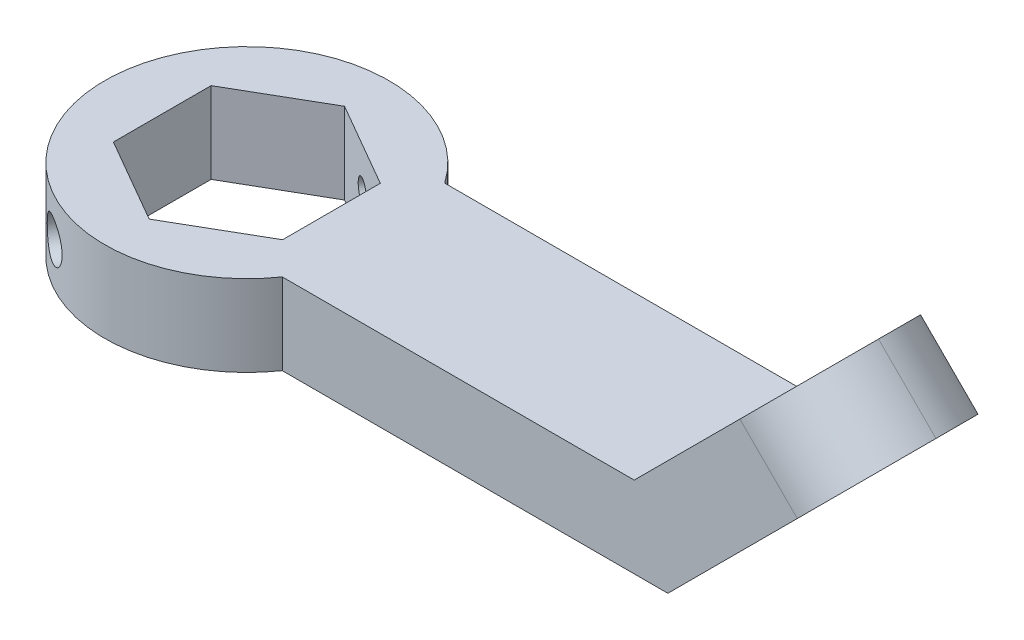
from build123d import *

# Parameters (mm, degrees)
BOSS_EXTRUDE1_DEPTH = 12
SKETCH4_W           = 39.051681067
SKETCH4_H           = 24
SKETCH4_R           = 4
BOSS_EXTRUDE2_DEPTH = 12
SKETCH4_3_R         = 8
SKETCH4_3_R_2       = 4
CUT_EXTRUDE1_DEPTH  = 5.15
FILLET1_R           = 12
SKETCH5_R           = 1.7
CUT_EXTRUDE2_DEPTH  = 107.997244305
CUT_EXTRUDE3_START  = -5
SKETCH5_3_R         = 3
CUT_EXTRUDE3_DEPTH  = 102.997244335


with BuildPart() as part:
    # Sketch3 → Boss-Extrude1 (new body)
    with BuildSketch(Plane(origin=(0, 0, 0), x_dir=(1, 0, 0), z_dir=(0, 1, 0))):
        with BuildLine():
            Line((-4.215390309, -12), (-17.23368794, -12))
            ThreePointArc((-17.23368794, -12), (0, -21), (17.23368794, -12))
            Line((17.23368794, -12), (4.215390309, -12))
            Line((4.215390309, -12), (0, -14.43375673))
            Line((0, -14.43375673), (-4.215390309, -12))
        make_face()
        with BuildLine():
            Line((17.23368794, 12), (4.215390309, 12))
            Line((4.215390309, 12), (12.5, 7.216878365))
            Line((12.5, 7.216878365), (12.5, -7.216878365))
            Line((12.5, -7.216878365), (4.215390309, -12))
            Line((4.215390309, -12), (17.23368794, -12))
            ThreePointArc((17.23368794, -12), (20.036310124, -6.288583039), (21, 0))
            ThreePointArc((21, 0), (20.036310124, 6.288583039), (17.23368794, 12))
        make_face()
        with BuildLine():
            Line((-12.5, 7.216878365), (-4.215390309, 12))
            Line((-4.215390309, 12), (-17.23368794, 12))
            ThreePointArc((-17.23368794, 12), (-21, 0), (-17.23368794, -12))
            Line((-17.23368794, -12), (-4.215390309, -12))
            Line((-4.215390309, -12), (-12.5, -7.216878365))
            Line((-12.5, -7.216878365), (-12.5, 7.216878365))
        make_face()
        with BuildLine():
            Line((-4.215390309, 12), (0, 14.43375673))
            Line((0, 14.43375673), (4.215390309, 12))
            Line((4.215390309, 12), (17.23368794, 12))
            ThreePointArc((17.23368794, 12), (0, 21), (-17.23368794, 12))
            Line((-17.23368794, 12), (-4.215390309, 12))
        make_face()
        with BuildLine():
            Line((74.2, 12), (17.23368794, 12))
            ThreePointArc((17.23368794, 12), (20.036310124, 6.288583039), (21, 0))
            ThreePointArc((21, 0), (20.036310124, -6.288583039), (17.23368794, -12))
            Line((17.23368794, -12), (74.2, -12))
            Line((74.2, -12), (74.2, 12))
        make_face()
    extrude(amount=BOSS_EXTRUDE1_DEPTH)

    # Sketch4 → Boss-Extrude2 (add)
    with BuildSketch(Plane(origin=(37.1, -37.1, 0), x_dir=(0.7071067811865462, 0.7071067811865489, 0), z_dir=(0.7071067811865489, -0.7071067811865462, 0))):
        with Locations((71.993163698, 0)):
            Rectangle(SKETCH4_W, SKETCH4_H)
        with Locations((75.519004231, 0)):
            Circle(SKETCH4_R, mode=Mode.SUBTRACT)
    extrude(amount=-BOSS_EXTRUDE2_DEPTH)

    # Sketch4<3> → Cut-Extrude1 (cut)
    with BuildSketch(Plane(origin=(37.1, -37.1, 0), x_dir=(0.7071067811865462, 0.7071067811865489, 0), z_dir=(0.7071067811865489, -0.7071067811865462, 0))):
        with Locations((75.519004231, 0)):
            Circle(SKETCH4_3_R)
        with Locations((75.519004231, 0)):
            Circle(SKETCH4_3_R_2, mode=Mode.SUBTRACT)
    extrude(amount=-CUT_EXTRUDE1_DEPTH, mode=Mode.SUBTRACT)

    # Fillet1
    fillet1_edges = [part.edges().sort_by_distance(p)[0] for p in [
        (97.571067812, 31.856349186, -12),
        (97.571067812, 31.856349186, 12),
    ]]
    fillet(fillet1_edges, radius=FILLET1_R - 0.0001)  # a hair under: the kernel refuses the full size

    # Sketch5 → Cut-Extrude2 (cut, through all)
    with BuildSketch(Plane(origin=(6.25, 0, -10.825317547), x_dir=(0.8660254037844386, 0, 0.5), z_dir=(-0.5000000000000001, 0, 0.8660254037844387))):
        with Locations((0, 6)):
            Circle(SKETCH5_R)
    cut_extrude2 = extrude(amount=-CUT_EXTRUDE2_DEPTH, mode=Mode.SUBTRACT)

    # Sketch5<3> → Cut-Extrude3 (cut, through all)
    with BuildSketch(Plane(origin=(6.25, 0, -10.825317547), x_dir=(0.8660254037844386, 0, 0.5), z_dir=(-0.5000000000000001, 0, 0.8660254037844387)).offset(CUT_EXTRUDE3_START)):
        with Locations((0, 6)):
            Circle(SKETCH5_3_R)
    cut_extrude3 = extrude(amount=-CUT_EXTRUDE3_DEPTH, mode=Mode.SUBTRACT)

    # Mirror1: Cut-Extrude2, Cut-Extrude3 across plane
    add(cut_extrude2.mirror(Plane(origin=(0, 0, 0), x_dir=(0.8660254037844386, 0, 0.5000000000000002), z_dir=(-0.5, 0, 0.8660254037844386))), mode=Mode.SUBTRACT)
    add(cut_extrude3.mirror(Plane(origin=(0, 0, 0), x_dir=(0.8660254037844386, 0, 0.5000000000000002), z_dir=(-0.5, 0, 0.8660254037844386))), mode=Mode.SUBTRACT)


solid = part.part
